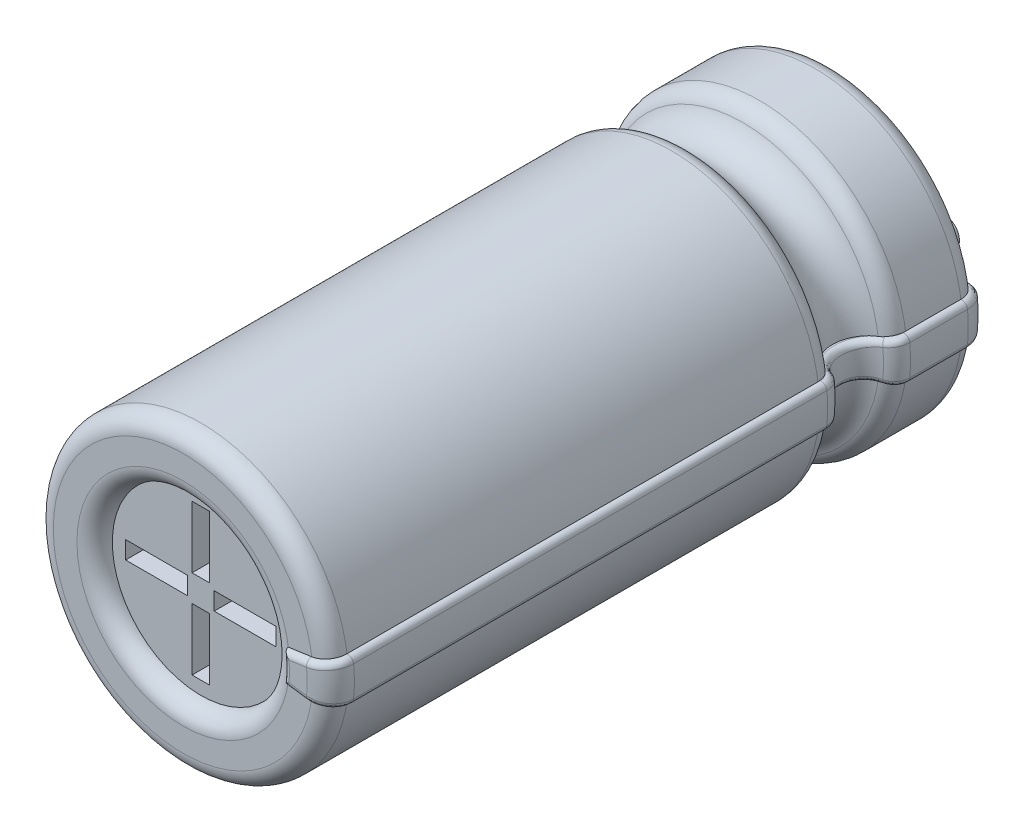
from build123d import *

# Parameters (mm, degrees)
SKETCH_4_R                = 2.5
EXTRUDE_1_DEPTH           = 11
SKETCH_5_R                = 1.5
CUT_EXTRUDE_1_DEPTH       = 0.3
SKETCH_7_R                = 0.5
SKETCH_8_R                = 1.275
CUT_EXTRUDE_2_DEPTH       = 0.3
FILLET_3_R                = 0.3
SKETCH_9_R                = 0.25
EXTRUDE_2_DEPTH           = 1.2
EXTRUDE_2_2_DEPTH         = 1.2
SKETCH_10_W               = 1.05
SKETCH_10_H               = 0.3
SKETCH_10_W_2             = 0.3
SKETCH_10_H_2             = 1.05
CUT_EXTRUDE_3_DEPTH       = 0.3
REVOLVE_2_ANGLE           = 8
REVOLVE_2_OTHER_WAY_ANGLE = 8
FILLET_4_R                = 0.1


with BuildPart() as part:
    # Эскиз4 → Бобышка-Вытянуть1 (new body)
    with BuildSketch(Plane.XY.offset(0.1)):
        Circle(SKETCH_4_R)
    extrude(amount=EXTRUDE_1_DEPTH)

    # Эскиз5 → Вырез-Вытянуть1 (cut)
    with BuildSketch(Plane.XY.offset(11.1)):
        Circle(SKETCH_5_R)
    extrude(amount=-CUT_EXTRUDE_1_DEPTH, mode=Mode.SUBTRACT)


with BuildPart() as body_2:
    # Эскиз7 → Повернуть1 (revolve)
    with BuildSketch(Plane(origin=(0, 0, 0), x_dir=(1, 0, 0), z_dir=(0, 1, 0))):
        with Locations((-2.5, -2.08)):
            Circle(SKETCH_7_R)
    revolve(axis=Axis((0, 0, 2.08), (0, 0, 1)))


with BuildPart() as part_1:
    add(part.part)

    # Combine 1: cut body 2
    add(body_2.part, mode=Mode.SUBTRACT)

    # Эскиз8 → Вырез-Вытянуть2 (cut)
    with BuildSketch(Plane(origin=(0, 0, 0.1), x_dir=(-1, 0, 0), z_dir=(0, 0, -1))):
        Circle(SKETCH_8_R)
    extrude(amount=-CUT_EXTRUDE_2_DEPTH, mode=Mode.SUBTRACT)

    # Скругление3
    fillet_3_edges = [part_1.edges().sort_by_distance(p)[0] for p in [
        (0, 2.5, 2.58),
        (0, -2.5, 1.58),
        (1.275, 0, 0.1),
        (-2.5, 0, 0.1),
        (-2.5, 0, 11.1),
        (-1.5, 0, 11.1),
    ]]
    fillet(fillet_3_edges, radius=FILLET_3_R - 0.0001)  # a hair under: the kernel refuses the full size

    # Эскиз10 → Вырез-Вытянуть3 (cut)
    with BuildSketch(Plane.XY.offset(10.8)):
        with Locations((0.75, 0)):
            Rectangle(SKETCH_10_W, SKETCH_10_H)
        with Locations((-0.75, 0)):
            Rectangle(SKETCH_10_W, SKETCH_10_H)
        with Locations((0, -0.75)):
            Rectangle(SKETCH_10_W_2, SKETCH_10_H_2)
        with Locations((0, 0.75)):
            Rectangle(SKETCH_10_W_2, SKETCH_10_H_2)
    extrude(amount=-CUT_EXTRUDE_3_DEPTH, mode=Mode.SUBTRACT)


with BuildPart() as body_2_2:
    # Эскиз9 → Бобышка-Вытянуть2 (new body)
    with BuildSketch(Plane(origin=(0, 0, 0.4), x_dir=(-1, 0, 0), z_dir=(0, 0, -1))):
        with Locations((-1, 0)):
            Circle(SKETCH_9_R)
    extrude(amount=EXTRUDE_2_DEPTH)


with BuildPart() as body_3:
    # Эскиз9 → Extrude 2 2 (new body)
    with BuildSketch(Plane(origin=(0, 0, 0.4), x_dir=(-1, 0, 0), z_dir=(0, 0, -1))):
        with Locations((1, 0)):
            Circle(SKETCH_9_R)
    extrude(amount=EXTRUDE_2_2_DEPTH)


with BuildPart() as body_4:
    # Эскиз12 → Повернуть2 (revolve)
    with BuildSketch(Plane(origin=(0, 0, 0), x_dir=(1, 0, 0), z_dir=(0, 1, 0))):
        with BuildLine():
            Line((1.575, 0), (1.8, -11.1))
            Line((1.8, -11.1), (1.8, -11.2))
            Line((1.8, -11.2), (2.2, -11.2))
            ThreePointArc((2.2, -11.2), (2.482842712, -11.082842712), (2.6, -10.8))
            Line((2.6, -10.8), (2.6, -2.782104831))
            ThreePointArc((2.6, -2.782104831), (2.55036262, -2.616821564), (2.417876277, -2.506233152))
            ThreePointArc((2.417876277, -2.506233152), (2.136487595, -2.08), (2.417876277, -1.653766848))
            ThreePointArc((2.417876277, -1.653766848), (2.55036262, -1.543178436), (2.6, -1.377895169))
            Line((2.6, -1.377895169), (2.6, -0.4))
            ThreePointArc((2.6, -0.4), (2.482842712, -0.117157288), (2.2, 0))
            Line((2.2, 0), (1.575, 0))
        make_face()
    revolve(axis=Axis((0, 0, 2.08), (0, 0, 1)), revolution_arc=REVOLVE_2_ANGLE)

    # Эскиз12 → Повернуть2 other way (revolve)
    with BuildSketch(Plane(origin=(0, 0, 0), x_dir=(1, 0, 0), z_dir=(0, 1, 0))):
        with BuildLine():
            Line((1.575, 0), (1.8, -11.1))
            Line((1.8, -11.1), (1.8, -11.2))
            Line((1.8, -11.2), (2.2, -11.2))
            ThreePointArc((2.2, -11.2), (2.482842712, -11.082842712), (2.6, -10.8))
            Line((2.6, -10.8), (2.6, -2.782104831))
            ThreePointArc((2.6, -2.782104831), (2.55036262, -2.616821564), (2.417876277, -2.506233152))
            ThreePointArc((2.417876277, -2.506233152), (2.136487595, -2.08), (2.417876277, -1.653766848))
            ThreePointArc((2.417876277, -1.653766848), (2.55036262, -1.543178436), (2.6, -1.377895169))
            Line((2.6, -1.377895169), (2.6, -0.4))
            ThreePointArc((2.6, -0.4), (2.482842712, -0.117157288), (2.2, 0))
            Line((2.2, 0), (1.575, 0))
        make_face()
    revolve(axis=Axis((0, 0, 2.08), (0, 0, -1)), revolution_arc=REVOLVE_2_OTHER_WAY_ANGLE)

    # Скругление4
    fillet_4_edges = [body_4.edges().sort_by_distance(p)[0] for p in [
        (1.86913098, -0.262689228, 0),
        (2.458679858, -0.345544919, 0.117157288),
        (2.574696979, -0.361850062, 0.888947585),
        (2.525542666, -0.354941874, 1.543178436),
        (2.115695444, -0.297341604, 2.08),
        (2.525542666, -0.354941874, 2.616821564),
        (2.574696979, -0.361850062, 6.791052415),
        (2.458679858, -0.345544919, 11.082842712),
        (1.86913098, 0.262689228, 0),
        (2.458679858, 0.345544919, 0.117157288),
        (2.574696979, 0.361850062, 0.888947585),
        (2.525542666, 0.354941874, 1.543178436),
        (2.115695444, 0.297341604, 2.08),
        (2.525542666, 0.354941874, 2.616821564),
        (2.574696979, 0.361850062, 6.791052415),
        (2.458679858, 0.345544919, 11.082842712),
        (1.575, 0, 0),
        (1.980536137, -0.278346202, 11.2),
        (1.980536137, 0.278346202, 11.2),
        (1.8, 0, 11.2),
    ]]
    fillet(fillet_4_edges, radius=FILLET_4_R - 0.0001)  # a hair under: the kernel refuses the full size


solid = Compound([part_1.part, body_2_2.part, body_3.part, body_4.part])
